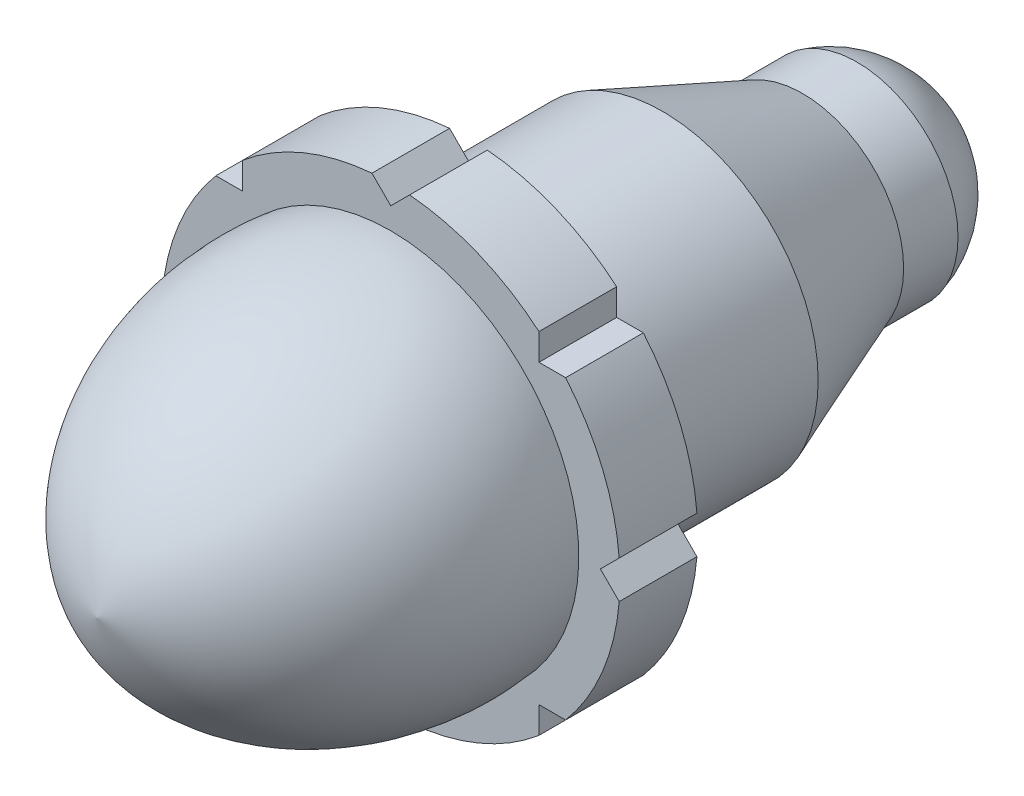
from build123d import *

# Parameters (mm, degrees)
DOME2_FACE_RADIUS  = 3.302
DOME2_HEIGHT       = 2.54
CUT_EXTRUDE2_DEPTH = 21.698272827
SEEDCUT_COUNT      = 8


# Read off the part's stored shape, not the designer's step: Cut-Revolve-Thin5
with BuildPart() as part:
    # Sketch5 → Revolve1 (revolve)
    with BuildSketch(Plane(origin=(0, 0, 0), x_dir=(0, 0, -1), z_dir=(1, 0, 0)), mode=Mode.PRIVATE) as revolve1_sk:
        Polygon((-10.655580084, 0), (-10.655580084, 7.493), (-8.115580084, 7.493), (-8.115580084, 5.08), (4.584419916, 5.08), (4.584419916, 0), align=None)
    revolve(revolve1_sk.sketch.rotate(Axis((0, 0, 7.652463568), (0, 0, -1)), 90), axis=Axis((0, 0, 7.652463568), (0, 0, -1)))

    # Sketch8 → Revolve3 (revolve)
    with BuildSketch(Plane(origin=(0, 0, 0), x_dir=(0, 0, -1), z_dir=(1, 0, 0))):
        with BuildLine():
            Line((-20.257637537, 0), (-10.655580084, 0))
            Line((-10.655580084, 0), (-10.655580084, 6.146975902))
            add(Edge.make_bspline(
                [(-10.655580084, 6.146975902), (-14.696094585, 6.626842046), (-19.387675836, 4.389685938), (-20.257637537, 0)],
                knots=[0, 0, 0, 0, 1, 1, 1, 1], degree=3))
        make_face()
    revolve(axis=Axis((0, 0, 7.652463568), (0, 0, 1)))

    # Cut-Revolve-Thin5 outline → Cut-Revolve-Thin5 (revolve, cut)
    with BuildSketch(Plane.XZ):
        Polygon((3.302, -2.806419916), (3.302, -4.584419916), (5.08, -4.584419916), (5.08, 1.765580084), align=None)
    revolve(axis=Axis((0, 0, 0), (0, 0, 1)), mode=Mode.SUBTRACT)

    # Dome2: a dome of height H over a round flat face of radius A is a cap of a sphere of radius (A * A + H * H) / (2 * H)
    dome2_r = (DOME2_FACE_RADIUS * DOME2_FACE_RADIUS + DOME2_HEIGHT * DOME2_HEIGHT) / (2 * DOME2_HEIGHT)
    dome2_base = Plane((0, 0, -4.584419916), z_dir=(0, 0, -1))
    with Locations(dome2_base.offset(DOME2_HEIGHT - dome2_r)):
        dome2_ball = Sphere(dome2_r, mode=Mode.PRIVATE)
    add(split(dome2_ball, bisect_by=dome2_base, keep=Keep.TOP, mode=Mode.PRIVATE))

    # Sketch12 → Cut-Extrude2 (cut, through all)
    with BuildSketch(Plane.XY.offset(10.655580084)):
        with BuildLine():
            Line((0, 6.851966826), (0.615694723, 7.467661549))
            ThreePointArc((0.615694723, 7.467661549), (0, 7.493), (-0.615694723, 7.467661549))
            Line((-0.615694723, 7.467661549), (0, 6.851966826))
        make_face()
    cut_extrude2 = extrude(amount=-CUT_EXTRUDE2_DEPTH, mode=Mode.SUBTRACT)

    # SeedCut: Cut-Extrude2 ×8 about axis
    seedcut_axis = Axis((0, 0, 0), (0, 0, 1))
    for i in range(1, SEEDCUT_COUNT):
        add(cut_extrude2.rotate(seedcut_axis, i * 360 / SEEDCUT_COUNT), mode=Mode.SUBTRACT)


solid = part.part
